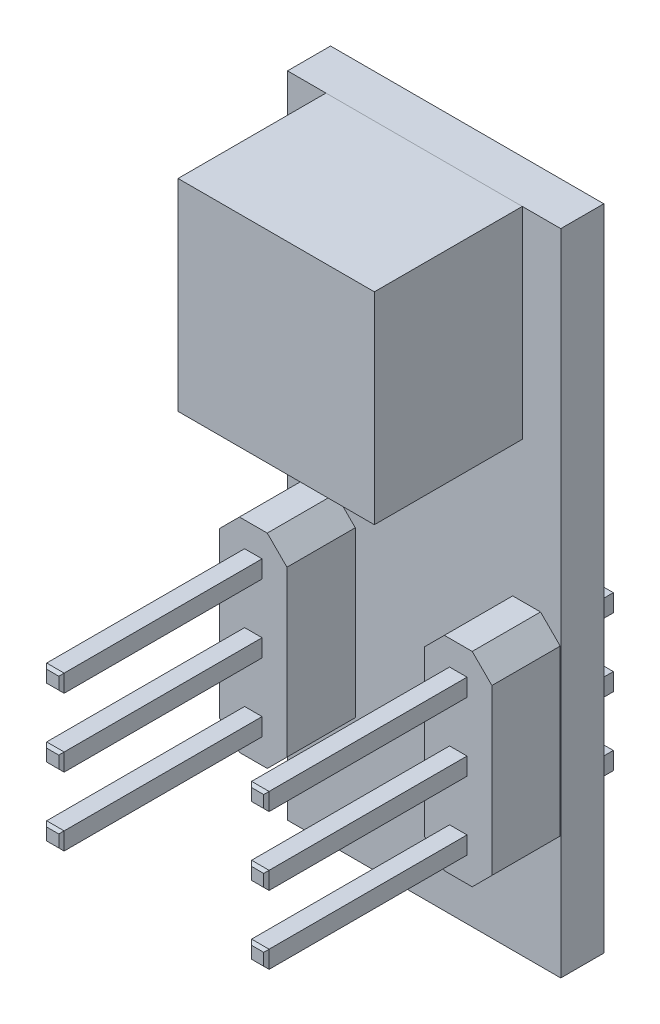
from build123d import *

# Parameters (mm, degrees)
SKETCH2_W                = 10.16
SKETCH2_H                = 24.13
SKETCH2_R                = 0.5
BOSS_EXTRUDE1_DEPTH      = 1.6
SKETCH3_W                = 7.3
SKETCH3_H                = 7.5
BOSS_EXTRUDE2_DEPTH      = 5.5
BOSS_EXTRUDE3_DEPTH      = 2.54
SKETCH9_W                = 0.65
SKETCH9_H                = 0.65
BOSS_EXTRUDE4_DEPTH      = 10
SKETCH9_2_W              = 0.65
SKETCH9_2_H              = 0.65
BOSS_EXTRUDE5_DEPTH      = 3
CHAMFER1_SIZE            = 0.1
CHAMFER1_OF_MIRROR2_SIZE = 0.1


with BuildPart() as part:
    # Sketch2 → Boss-Extrude1 (new body)
    with BuildSketch(Plane.XY):
        with Locations((5.08, 12.065)):
            Rectangle(SKETCH2_W, SKETCH2_H)
        with Locations((1.27, 5.08)):
            Circle(SKETCH2_R, mode=Mode.SUBTRACT)
        with Locations((1.27, 7.62)):
            Circle(SKETCH2_R, mode=Mode.SUBTRACT)
        with Locations((1.27, 10.16)):
            Circle(SKETCH2_R, mode=Mode.SUBTRACT)
        with Locations((8.89, 10.16)):
            Circle(SKETCH2_R, mode=Mode.SUBTRACT)
        with Locations((8.89, 7.62)):
            Circle(SKETCH2_R, mode=Mode.SUBTRACT)
        with Locations((8.89, 5.08)):
            Circle(SKETCH2_R, mode=Mode.SUBTRACT)
    extrude(amount=BOSS_EXTRUDE1_DEPTH)

    # Sketch8 → Boss-Extrude3 (add)
    with BuildSketch(Plane.XY.offset(1.6)):
        Polygon((0.02, 10.677766953), (0.02, 4.562233047), (0.752233047, 3.83), (1.787766953, 3.83), (2.52, 4.562233047), (2.52, 10.677766953), (1.787766953, 11.41), (0.752233047, 11.41), align=None)
    boss_extrude3 = extrude(amount=BOSS_EXTRUDE3_DEPTH)

    # Sketch9 → Boss-Extrude4 (add)
    with BuildSketch(Plane.XY.offset(1.6)):
        with Locations((1.27, 10.16)):
            Rectangle(SKETCH9_W, SKETCH9_H)
        with Locations((1.27, 7.62)):
            Rectangle(SKETCH9_W, SKETCH9_H)
        with Locations((1.27, 5.08)):
            Rectangle(SKETCH9_W, SKETCH9_H)
    boss_extrude4 = extrude(amount=BOSS_EXTRUDE4_DEPTH)

    # Sketch9<2> → Boss-Extrude5 (add)
    with BuildSketch(Plane.XY.offset(1.6)):
        with Locations((1.27, 10.16)):
            Rectangle(SKETCH9_2_W, SKETCH9_2_H)
        with Locations((1.27, 7.62)):
            Rectangle(SKETCH9_2_W, SKETCH9_2_H)
        with Locations((1.27, 5.08)):
            Rectangle(SKETCH9_2_W, SKETCH9_2_H)
    boss_extrude5 = extrude(amount=-BOSS_EXTRUDE5_DEPTH)

    # Chamfer1
    chamfer1_edges = [part.edges().sort_by_distance(p)[0] for p in [
        (1.27, 4.755, -1.4),
        (1.595, 5.08, -1.4),
        (1.27, 5.405, -1.4),
        (0.945, 5.08, -1.4),
        (1.27, 7.295, -1.4),
        (1.595, 7.62, -1.4),
        (1.27, 7.945, -1.4),
        (0.945, 7.62, -1.4),
        (1.27, 9.835, -1.4),
        (1.595, 10.16, -1.4),
        (1.27, 10.485, -1.4),
        (0.945, 10.16, -1.4),
        (1.27, 5.405, 11.6),
        (1.595, 5.08, 11.6),
        (1.27, 4.755, 11.6),
        (0.945, 5.08, 11.6),
        (1.27, 7.945, 11.6),
        (1.595, 7.62, 11.6),
        (1.27, 7.295, 11.6),
        (0.945, 7.62, 11.6),
        (1.27, 10.485, 11.6),
        (1.595, 10.16, 11.6),
        (1.27, 9.835, 11.6),
        (0.945, 10.16, 11.6),
    ]]
    chamfer(chamfer1_edges, length=CHAMFER1_SIZE)

    # Mirror1: Boss-Extrude3 across plane
    add(boss_extrude3.mirror(Plane(origin=(5.08, 0, 0), x_dir=(0, 0, 1), z_dir=(1, 0, 0))))

    # Mirror2: Boss-Extrude4, Boss-Extrude5 across plane
    add(boss_extrude4.mirror(Plane(origin=(5.08, 0, 0), x_dir=(0, 0, 1), z_dir=(1, 0, 0))))
    add(boss_extrude5.mirror(Plane(origin=(5.08, 0, 0), x_dir=(0, 0, 1), z_dir=(1, 0, 0))))

    # Chamfer1 of Mirror2
    chamfer1_of_mirror2_edges = [part.edges().sort_by_distance(p)[0] for p in [
        (8.89, 4.755, -1.4),
        (8.565, 5.08, -1.4),
        (8.89, 5.405, -1.4),
        (9.215, 5.08, -1.4),
        (8.89, 7.295, -1.4),
        (8.565, 7.62, -1.4),
        (8.89, 7.945, -1.4),
        (9.215, 7.62, -1.4),
        (8.89, 9.835, -1.4),
        (8.565, 10.16, -1.4),
        (8.89, 10.485, -1.4),
        (9.215, 10.16, -1.4),
        (8.89, 5.405, 11.6),
        (8.565, 5.08, 11.6),
        (8.89, 4.755, 11.6),
        (9.215, 5.08, 11.6),
        (8.89, 7.945, 11.6),
        (8.565, 7.62, 11.6),
        (8.89, 7.295, 11.6),
        (9.215, 7.62, 11.6),
        (8.89, 10.485, 11.6),
        (8.565, 10.16, 11.6),
        (8.89, 9.835, 11.6),
        (9.215, 10.16, 11.6),
    ]]
    chamfer(chamfer1_of_mirror2_edges, length=CHAMFER1_OF_MIRROR2_SIZE)


with BuildPart() as body_2:
    # Sketch3 → Boss-Extrude2 (new body)
    with BuildSketch(Plane.XY.offset(1.6)):
        with Locations((5.08, 20.38)):
            Rectangle(SKETCH3_W, SKETCH3_H)
    extrude(amount=BOSS_EXTRUDE2_DEPTH)


solid = Compound([part.part, body_2.part])
